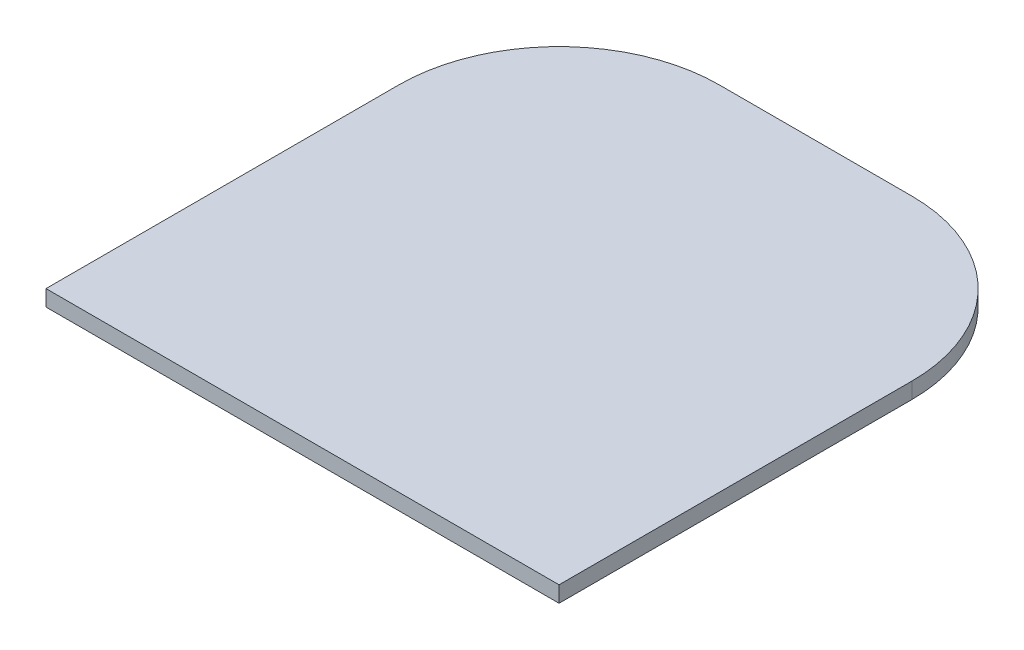
from build123d import *

# Parameters (mm, degrees)
SKETCH1_W           = 203.2
SKETCH1_H           = 203.2
BOSS_EXTRUDE1_DEPTH = 6.35
CUT_EXTRUDE1_DEPTH  = 144.824345992


with BuildPart() as part:
    # Sketch1 → Boss-Extrude1 (new body)
    with BuildSketch(Plane(origin=(0, 0, 0), x_dir=(1, 0, 0), z_dir=(0, 1, 0))):
        Rectangle(SKETCH1_W, SKETCH1_H)
    extrude(amount=BOSS_EXTRUDE1_DEPTH)

    # Sketch2 → Cut-Extrude1 (cut, through all)
    with BuildSketch(Plane(origin=(0, 6.35, 0), x_dir=(1, 0, 0), z_dir=(0, 1, 0))):
        with BuildLine():
            Line((101.6, 38.1), (101.6, 101.6))
            Line((101.6, 101.6), (38.1, 101.6))
            ThreePointArc((38.1, 101.6), (83.001280605, 83.001280605), (101.6, 38.1))
        make_face()
        with BuildLine():
            Line((-38.1, 101.6), (-101.6, 101.6))
            Line((-101.6, 101.6), (-101.6, 38.1))
            ThreePointArc((-101.6, 38.1), (-83.001280605, 83.001280605), (-38.1, 101.6))
        make_face()
    extrude(amount=-CUT_EXTRUDE1_DEPTH, mode=Mode.SUBTRACT)


solid = part.part
